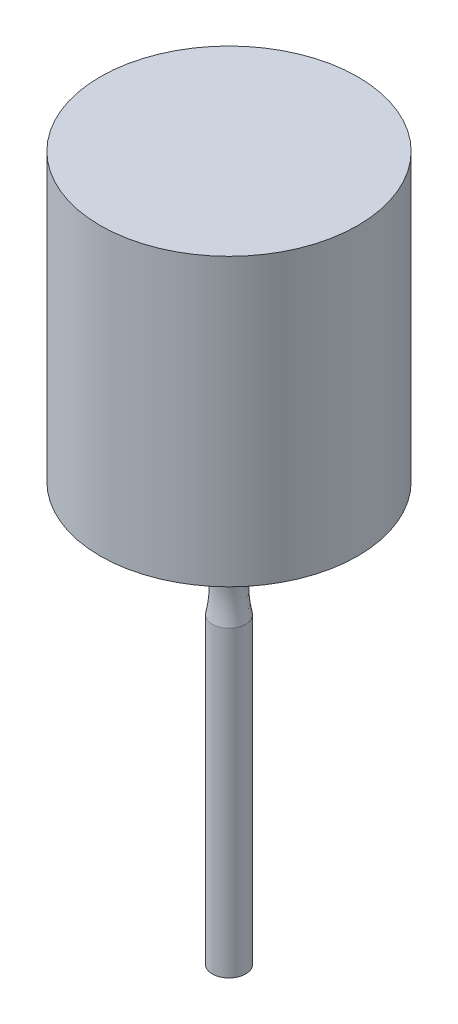
from build123d import *

# Parameters (mm, degrees)
SKETCH1_R           = 27
BOSS_EXTRUDE1_DEPTH = 60
SKETCH2_R           = 25.527
SKETCH2_R_2         = 22.0345
CUT_EXTRUDE1_DEPTH  = 1.9558
SKETCH3_R           = 2
CUT_EXTRUDE2_DEPTH  = 8
SKETCH8_R           = 3.4925
BOSS_EXTRUDE2_DEPTH = 63.5


with BuildPart() as part:
    # Sketch1 → Boss-Extrude1 (new body)
    with BuildSketch(Plane(origin=(0, 0, 0), x_dir=(1, 0, 0), z_dir=(0, 1, 0))):
        with Locations(Location((0, 0, 0), (0, 0, 270))):
            Circle(SKETCH1_R)
    extrude(amount=BOSS_EXTRUDE1_DEPTH)

    # Sketch2 → Cut-Extrude1 (cut)
    with BuildSketch(Plane.XZ):
        with Locations(Location((0, 0, 0), (0, 0, 270))):
            Circle(SKETCH2_R)
        with Locations(Location((0, 0, 0), (0, 0, 270))):
            Circle(SKETCH2_R_2, mode=Mode.SUBTRACT)
    extrude(amount=-CUT_EXTRUDE1_DEPTH, mode=Mode.SUBTRACT)

    # Sketch3 → Cut-Extrude2 (cut)
    with BuildSketch(Plane.XZ):
        with Locations(Location((0, 17, 0), (0, 0, 270))):
            Circle(SKETCH3_R)
        with Locations(Location((14.722431864, 8.5, 0), (0, 0, 270))):
            Circle(SKETCH3_R)
        with Locations(Location((14.722431864, -8.5, 0), (0, 0, 270))):
            Circle(SKETCH3_R)
        with Locations(Location((0, -17, 0), (0, 0, 270))):
            Circle(SKETCH3_R)
        with Locations(Location((-14.722431864, -8.5, 0), (0, 0, 270))):
            Circle(SKETCH3_R)
        with Locations(Location((-14.722431864, 8.5, 0), (0, 0, 270))):
            Circle(SKETCH3_R)
    extrude(amount=-CUT_EXTRUDE2_DEPTH, mode=Mode.SUBTRACT)

    # Loft1: read off the stored shape, not the designer's step
    # Loft1: loft between two sections, ruled curve by curve
    loft1_from = [
        Edge.make_bspline([(-3.433483362, -24.13, 0.639334225), (-2.154814912, -24.13, 7.50630095), (4.712151812, -24.13, 6.227632499), (3.433483362, -24.13, -0.639334225), (2.154814912, -24.13, -7.50630095), (-4.712151812, -24.13, -6.227632499), (-3.433483362, -24.13, 0.639334225)], [0, 0, 0, 0, 0.5, 0.5, 0.5, 1, 1, 1, 1], 3, [1, 0.333333333, 0.333333333, 1, 0.333333333, 0.333333333, 1]),
    ]
    loft1_to = [
        Edge.make_bspline([(0, 0, -7.62), (-15.24, 0, -7.62), (-15.24, 0, 7.62), (0, 0, 7.62), (15.24, 0, 7.62), (15.24, 0, -7.62), (0, 0, -7.62)], [0, 0, 0, 0, 0.5, 0.5, 0.5, 1, 1, 1, 1], 3, [1, 0.333333333, 0.333333333, 1, 0.333333333, 0.333333333, 1]),
    ]
    loft1 = Solid(Shell([*[Face.make_surface_from_curves(loft1_from[k], loft1_to[k]) for k in range(1)], Face(Wire(loft1_from)), Face(Wire(loft1_to))]))
    add(loft1)

    # Sketch8 → Boss-Extrude2 (add)
    with BuildSketch(Plane.XZ.offset(24.13)):
        with Locations(Location((0, 0, 0), (0, 0, 169.452))):
            Circle(SKETCH8_R)
    extrude(amount=BOSS_EXTRUDE2_DEPTH)


solid = part.part
